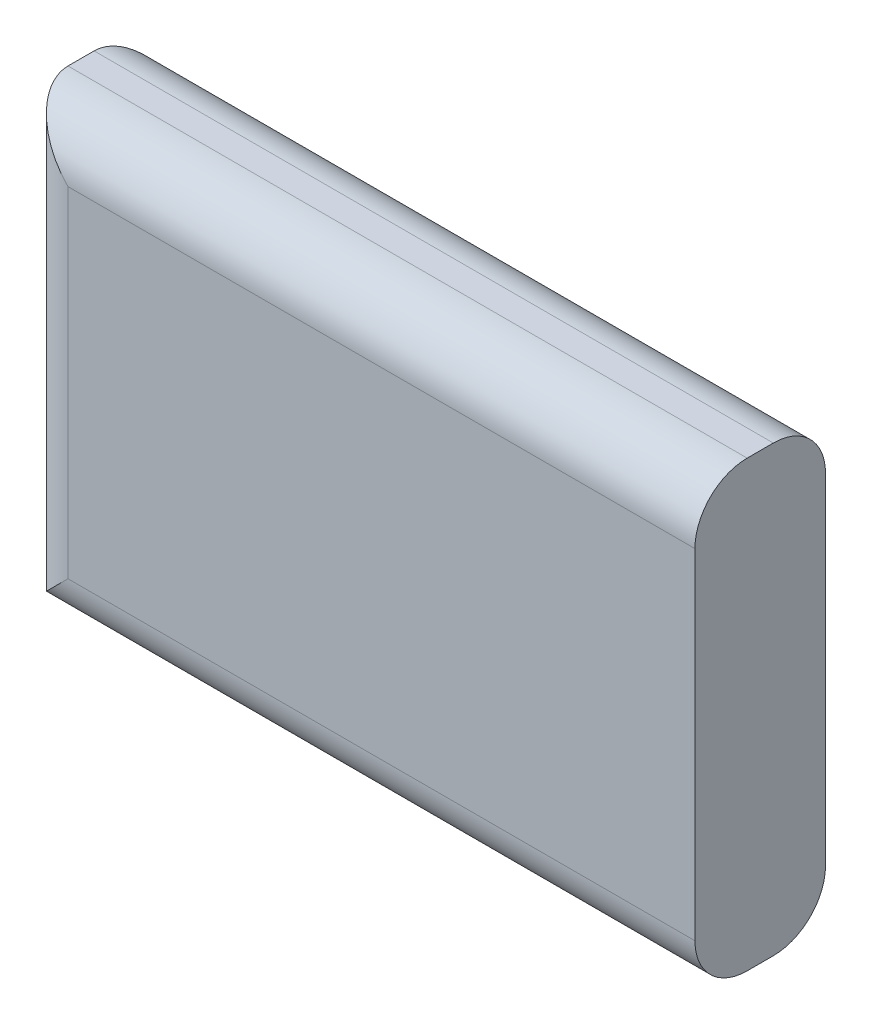
from build123d import *

# Parameters (mm, degrees)
SKETCH1_W           = 52
SKETCH1_H           = 34
BOSS_EXTRUDE1_DEPTH = 5
FILLET1_R           = 4


with BuildPart() as part:
    # Sketch1 → Boss-Extrude1 (new, symmetric)
    with BuildSketch(Plane.XY):
        Rectangle(SKETCH1_W, SKETCH1_H)
    extrude(amount=BOSS_EXTRUDE1_DEPTH, both=True)

    # Fillet1
    fillet1_edges = [part.edges().sort_by_distance(p)[0] for p in [
        (-26, 0, 5),
        (-26, 0, -5),
        (0, -17, -5),
        (0, -17, 5),
        (0, 17, -5),
        (0, 17, 5),
    ]]
    fillet(fillet1_edges, radius=FILLET1_R)


solid = part.part
